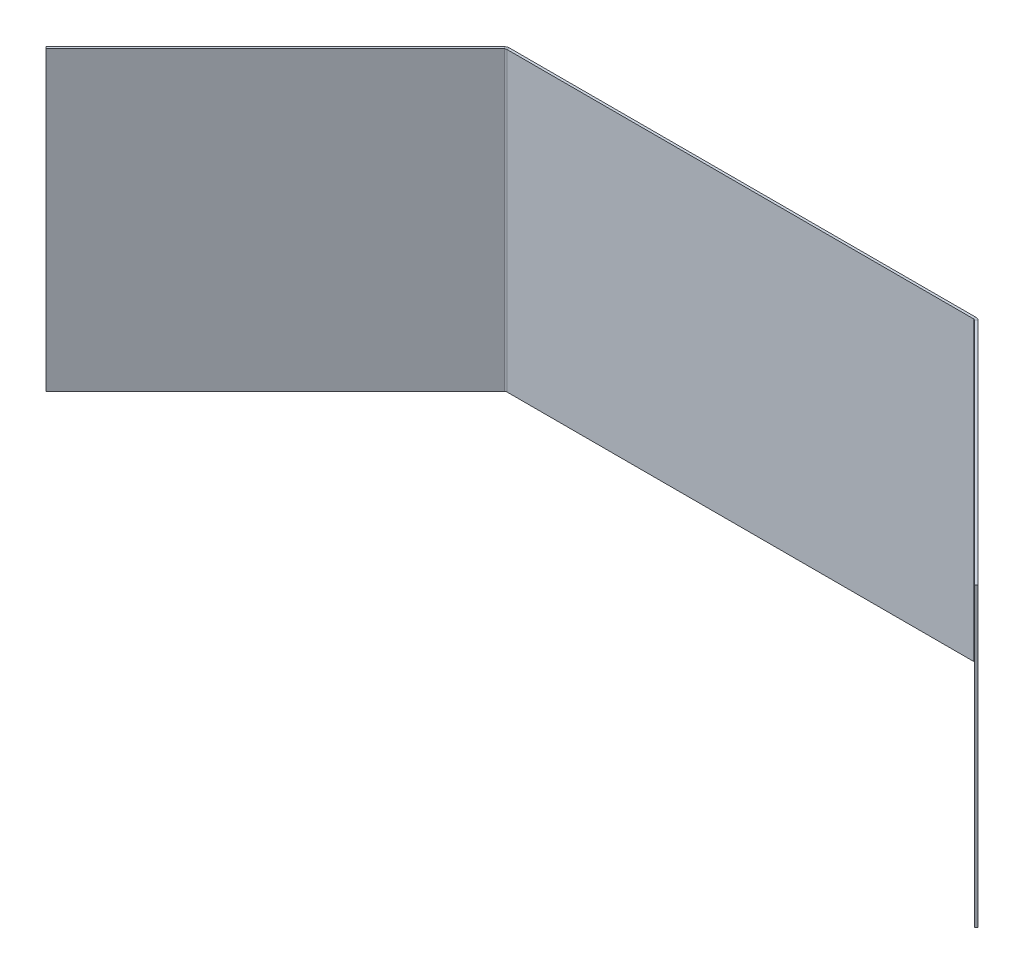
from build123d import *

# Parameters (mm, degrees)
SM_BASE_FLANGE_1_DEPTH = 117.5


# Sheet-metal steps are written as plain solids
with BuildPart() as part:
    # Sketch 1 → 基体-法兰1 (new, symmetric)
    with BuildSketch(Plane(origin=(0, 0, 0), x_dir=(1, 0, 0), z_dir=(0, 1, 0))):
        with BuildLine():
            Line((-367.697925088, -182.072925088), (-186.210786438, -0.585786438))
            ThreePointArc((-186.210786438, -0.585786438), (-185.56193974, -0.152240935), (-184.796572875, 0))
            Line((-184.796572875, 0), (184.796572875, 0))
            ThreePointArc((184.796572875, 0), (185.56193974, -0.152240935), (186.210786438, -0.585786438))
            Line((186.210786438, -0.585786438), (367.697925088, -182.072925088))
            Line((367.697925088, -182.072925088), (369.11213865, -180.658711525))
            Line((369.11213865, -180.658711525), (187.625, 0.828427125))
            ThreePointArc((187.625, 0.828427125), (186.327306605, 1.69551813), (184.796572875, 2))
            Line((184.796572875, 2), (-184.796572875, 2))
            ThreePointArc((-184.796572875, 2), (-186.327306605, 1.69551813), (-187.625, 0.828427125))
            Line((-187.625, 0.828427125), (-369.11213865, -180.658711525))
            Line((-369.11213865, -180.658711525), (-367.697925088, -182.072925088))
        make_face()
    extrude(amount=SM_BASE_FLANGE_1_DEPTH, both=True)


solid = part.part
